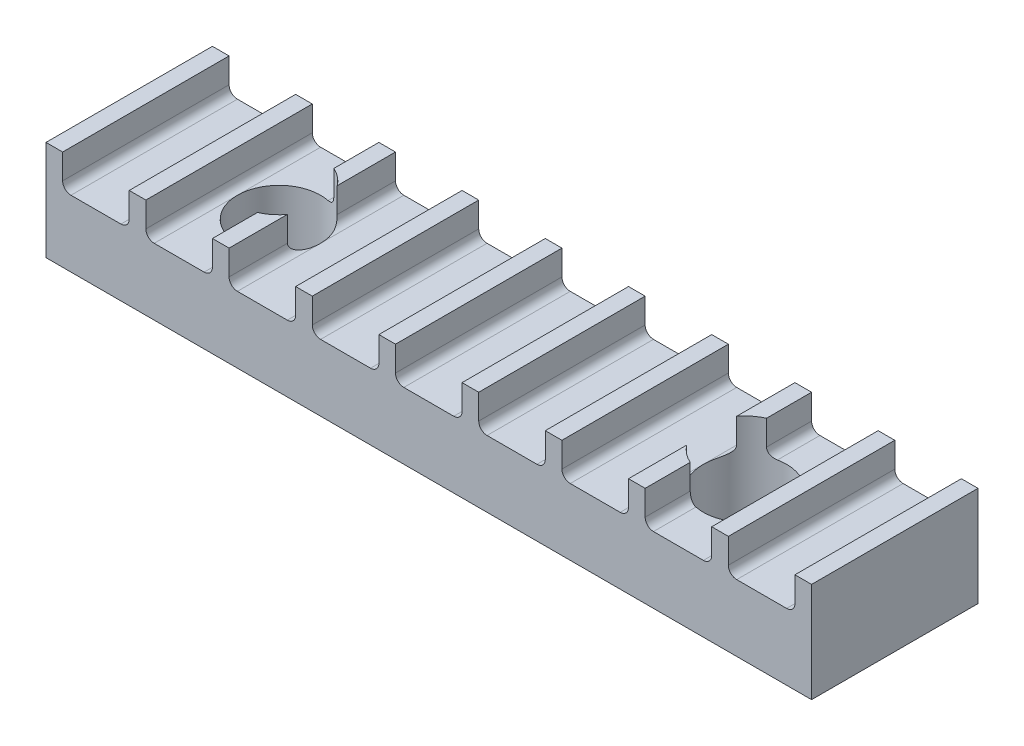
from build123d import *

# Parameters (mm, degrees)
SKETCH1_W           = 46
SKETCH1_H           = 10
SKETCH1_R           = 2.5
BOSS_EXTRUDE1_DEPTH = 6
SKETCH2_W           = 4
SKETCH2_H           = 2
CUT_EXTRUDE1_DEPTH  = 26.787593916
FILLET2_R           = 0.5


with BuildPart() as part:
    # Sketch1 → Boss-Extrude1 (new body)
    with BuildSketch(Plane(origin=(0, 0, 0), x_dir=(1, 0, 0), z_dir=(0, 1, 0))):
        Rectangle(SKETCH1_W, SKETCH1_H)
        with Locations(Location((14, 0, 0), (0, 0, 270))):
            Circle(SKETCH1_R, mode=Mode.SUBTRACT)
        with Locations(Location((-14, 0, 0), (0, 0, 270))):
            Circle(SKETCH1_R, mode=Mode.SUBTRACT)
    extrude(amount=BOSS_EXTRUDE1_DEPTH)

    # Sketch2 → Cut-Extrude1 (cut, through all)
    with BuildSketch(Plane.XY.offset(5)):
        with Locations((-20, 5)):
            Rectangle(SKETCH2_W, SKETCH2_H)
        with Locations((-15, 5)):
            Rectangle(SKETCH2_W, SKETCH2_H)
        with Locations((-10, 5)):
            Rectangle(SKETCH2_W, SKETCH2_H)
        with Locations((-5, 5)):
            Rectangle(SKETCH2_W, SKETCH2_H)
        with Locations((0, 5)):
            Rectangle(SKETCH2_W, SKETCH2_H)
        with Locations((5, 5)):
            Rectangle(SKETCH2_W, SKETCH2_H)
        with Locations((10, 5)):
            Rectangle(SKETCH2_W, SKETCH2_H)
        with Locations((15, 5)):
            Rectangle(SKETCH2_W, SKETCH2_H)
        with Locations((20, 5)):
            Rectangle(SKETCH2_W, SKETCH2_H)
    extrude(amount=-CUT_EXTRUDE1_DEPTH, mode=Mode.SUBTRACT)

    # Fillet2
    fillet2_edges = [part.edges().sort_by_distance(p)[0] for p in [
        (3, 4, 0),
        (7, 4, 0),
        (8, 4, 0),
        (12, 4, 3.25),
        (12, 4, -3.25),
        (13, 4, -3.645643924),
        (13, 4, 3.645643924),
        (17, 4, 0),
        (18, 4, 0),
        (22, 4, 0),
        (-18, 4, 0),
        (-22, 4, 0),
        (-13, 4, 3.645643924),
        (-13, 4, -3.645643924),
        (-17, 4, 0),
        (-12, 4, -3.25),
        (-12, 4, 3.25),
        (-8, 4, 0),
        (-7, 4, 0),
        (-3, 4, 0),
        (-2, 4, 0),
        (2, 4, 0),
    ]]
    fillet(fillet2_edges, radius=FILLET2_R - 0.0001)  # a hair under: the kernel refuses the full size


solid = part.part
